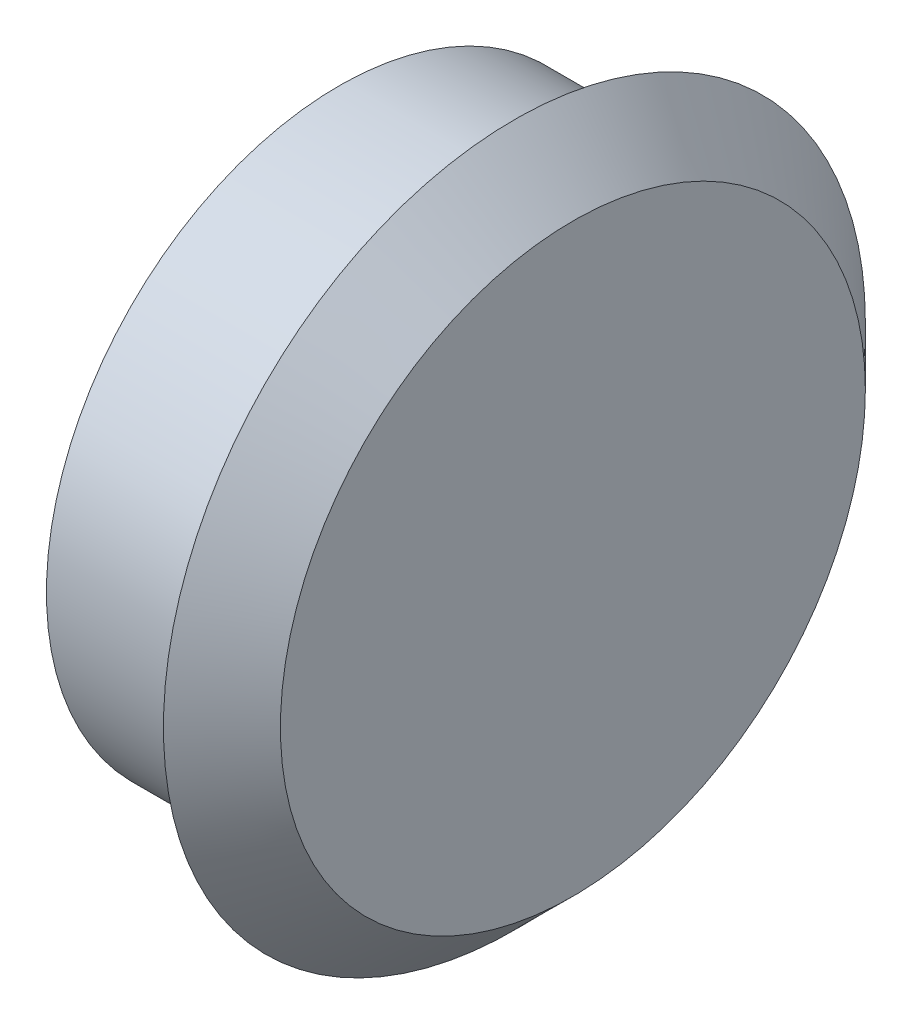
from build123d import *

# Parameters (mm, degrees)
SKETCH_1_R      = 50
SKETCH_1_R_2    = 45
EXTRUDE_1_DEPTH = 30
SKETCH_2_R      = 60
EXTRUDE_2_DEPTH = 10
CHAMFER_1_SIZE  = 10


with BuildPart() as part:
    # Эскиз1 → Бобышка-Вытянуть1 (new body)
    with BuildSketch(Plane(origin=(0, 0, 0), x_dir=(0, 0, -1), z_dir=(1, 0, 0))):
        Circle(SKETCH_1_R)
        Circle(SKETCH_1_R_2, mode=Mode.SUBTRACT)
    extrude(amount=EXTRUDE_1_DEPTH)

    # Эскиз2 → Бобышка-Вытянуть2 (add)
    with BuildSketch(Plane(origin=(30, 0, 0), x_dir=(0, 0, -1), z_dir=(1, 0, 0))):
        Circle(SKETCH_2_R)
    extrude(amount=EXTRUDE_2_DEPTH)

    # Фаска1
    chamfer_1_edges = [part.edges().sort_by_distance(p)[0] for p in [
        (40, 0, 60),
    ]]
    chamfer(chamfer_1_edges, length=CHAMFER_1_SIZE - 0.0001)  # a hair under: the kernel refuses the full size


solid = part.part
